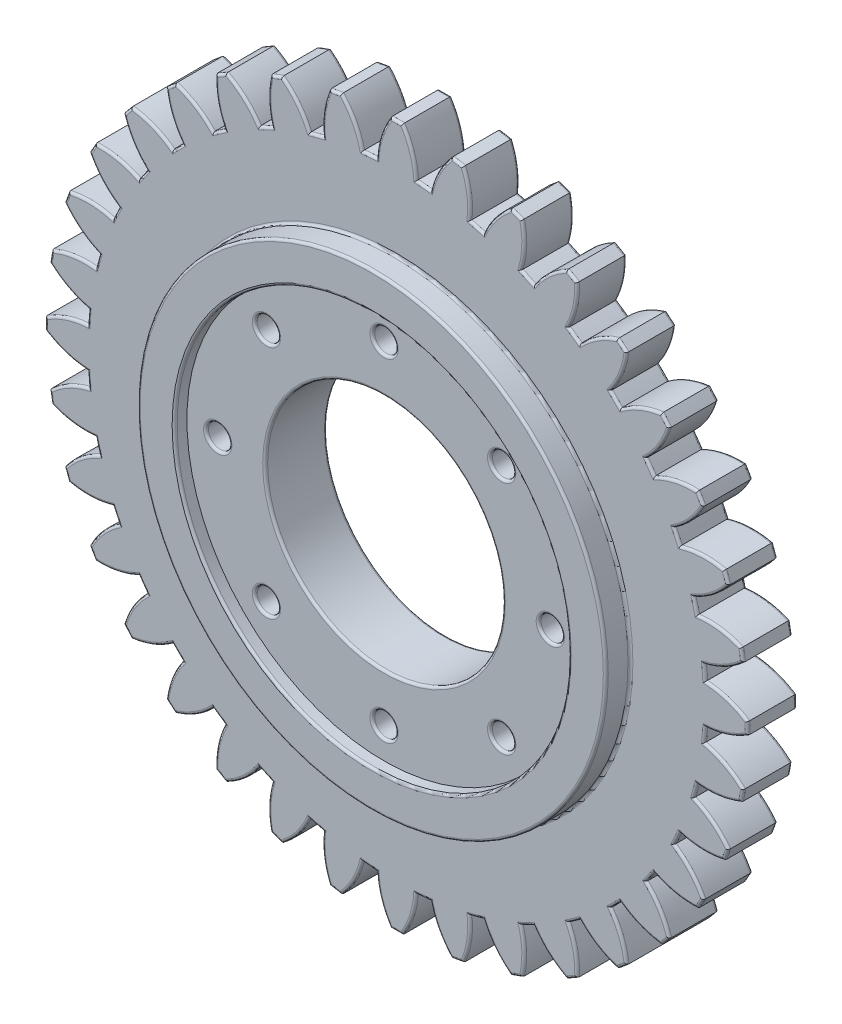
from build123d import *

# Parameters (mm, degrees)
SKETCH_1_R               = 25.125
EXTRUDE_1_DEPTH          = 4
EXTRUDE_2_DEPTH          = 4
PATTERN_CIRCULAR_1_COUNT = 36
SKETCH_2_R               = 9.65
CUT_EXTRUDE_1_DEPTH      = 10
EXTRUDE_START            = 1
SKETCH_4_R               = 16
SKETCH_4_R_2             = 9.65
EXTRUDE_3_DEPTH          = 1
SKETCH_5_R               = 0.95
CUT_EXTRUDE_2_DEPTH      = 41.614037135
EXTRUDE_START_2          = 2
SKETCH_6_R               = 19
SKETCH_6_R_2             = 16
EXTRUDE_4_DEPTH          = 2
FILLET_1_R               = 0.2


with BuildPart() as part:
    # 스케치1 → 보스-돌출1 (new body)
    with BuildSketch(Plane.XY):
        Circle(SKETCH_1_R)
    extrude(amount=EXTRUDE_1_DEPTH)

    # 스케치1<3> → 보스-돌출2 (add)
    with BuildSketch(Plane.XY):
        with BuildLine():
            add(Edge.make_bspline(
                [(0.485835725, 28.49585871), (1.498424124, 26.93681997), (1.610835725, 25.073309181)],
                knots=[0, 0, 0, 1, 1, 1], degree=2))
            ThreePointArc((0.485835725, 28.49585871), (0, 28.5), (-0.485835725, 28.49585871))
            add(Edge.make_bspline(
                [(-0.485835725, 28.49585871), (-1.498424124, 26.93681997), (-1.610835725, 25.073309181)],
                knots=[0, 0, 0, 1, 1, 1], degree=2))
            ThreePointArc((-1.610835725, 25.073309181), (0, 25.125), (1.610835725, 25.073309181))
        make_face()
    extrude_2 = extrude(amount=EXTRUDE_2_DEPTH)

    # 원형 패턴1: 보스-돌출2 ×36 about axis
    pattern_circular_1_axis = Axis((0, 0, 4), (0, 0, -1))
    for i in range(1, PATTERN_CIRCULAR_1_COUNT):
        add(extrude_2.rotate(pattern_circular_1_axis, i * 360 / PATTERN_CIRCULAR_1_COUNT))

    # 스케치2 → 컷-돌출1 (cut)
    with BuildSketch(Plane.XY.offset(4)):
        Circle(SKETCH_2_R)
    extrude(amount=-CUT_EXTRUDE_1_DEPTH, mode=Mode.SUBTRACT)

    # 스케치4 → 보스-돌출3 (add)
    with BuildSketch(Plane.XY.offset(4).offset(EXTRUDE_START)):
        Circle(SKETCH_4_R)
        Circle(SKETCH_4_R_2, mode=Mode.SUBTRACT)
    extrude(amount=-EXTRUDE_3_DEPTH)

    # 스케치5 → 컷-돌출2 (cut, through all)
    with BuildSketch(Plane.XY.offset(5)):
        with Locations((13.5, 0)):
            Circle(SKETCH_5_R)
        with Locations((9.545941546, -9.545941546)):
            Circle(SKETCH_5_R)
        with Locations((0, -13.5)):
            Circle(SKETCH_5_R)
        with Locations((-9.545941546, -9.545941546)):
            Circle(SKETCH_5_R)
        with Locations((-13.5, 0)):
            Circle(SKETCH_5_R)
        with Locations((-9.545941546, 9.545941546)):
            Circle(SKETCH_5_R)
        with Locations((0, 13.5)):
            Circle(SKETCH_5_R)
        with Locations((9.545941546, 9.545941546)):
            Circle(SKETCH_5_R)
    extrude(amount=-CUT_EXTRUDE_2_DEPTH, mode=Mode.SUBTRACT)

    # 스케치6 → 보스-돌출4 (add)
    with BuildSketch(Plane.XY.offset(4).offset(EXTRUDE_START_2)):
        Circle(SKETCH_6_R)
        Circle(SKETCH_6_R_2, mode=Mode.SUBTRACT)
    extrude(amount=-EXTRUDE_4_DEPTH)

    # 필렛1
    fillet_1_edges = [part.edges().sort_by_distance(p)[0] for p in [
        (-26.229523951, 5.918631747, 4),
        (-28.067020961, 4.948973064, 0),
        (-26.671981382, 3.409330963, 0),
        (-28.067020961, 4.948973064, 4),
        (-26.671981382, 3.409330963, 4),
        (-26.229523951, 5.918631747, 0),
        (-25.02939179, -2.189788037, 0),
        (-25.02939179, -2.189788037, 4),
        (-26.858798162, 1.274005397, 4),
        (-28.5, 0, 0),
        (-26.858798162, -1.274005397, 0),
        (-28.5, 0, 4),
        (-26.858798162, -1.274005397, 4),
        (-26.858798162, 1.274005397, 0),
        (-24.268886386, -6.502828508, 0),
        (-24.268886386, -6.502828508, 4),
        (-26.671981382, -3.409330963, 4),
        (-28.067020961, -4.948973064, 0),
        (-26.229523951, -5.918631747, 0),
        (-28.067020961, -4.948973064, 4),
        (-26.229523951, -5.918631747, 4),
        (-26.671981382, -3.409330963, 0),
        (-22.770983149, -10.618283826, 0),
        (-22.770983149, -10.618283826, 4),
        (-25.674749945, -7.989076527, 4),
        (-26.781239692, -9.747574085, 0),
        (-24.803278928, -10.383423467, 0),
        (-26.781239692, -9.747574085, 4),
        (-24.803278928, -10.383423467, 4),
        (-25.674749945, -7.989076527, 0),
        (-20.581195113, -14.411107963, 0),
        (-20.581195113, -14.411107963, 4),
        (-23.897404222, -12.326078043, 4),
        (-24.681724008, -14.25, 0),
        (-22.623398825, -14.532720119, 0),
        (-24.681724008, -14.25, 4),
        (-22.623398825, -14.532720119, 4),
        (-23.897404222, -12.326078043, 0),
        (-17.766057877, -17.766057877, 0),
        (-17.766057877, -17.766057877, 4),
        (-21.393947965, -16.288557915, 4),
        (-21.832266629, -18.319446876, 0),
        (-19.756118197, -18.240447425, 0),
        (-21.832266629, -18.319446876, 4),
        (-19.756118197, -18.240447425, 4),
        (-21.393947965, -16.288557915, 0),
        (-14.411107963, -20.581195113, 0),
        (-14.411107963, -20.581195113, 4),
        (-18.240447425, -19.756118197, 4),
        (-18.319446876, -21.832266629, 0),
        (-16.288557915, -21.393947965, 0),
        (-18.319446876, -21.832266629, 4),
        (-16.288557915, -21.393947965, 4),
        (-18.240447425, -19.756118197, 0),
        (-10.618283826, -22.770983149, 0),
        (-10.618283826, -22.770983149, 4),
        (-14.532720119, -22.623398825, 4),
        (-14.25, -24.681724008, 0),
        (-12.326078043, -23.897404222, 0),
        (-14.25, -24.681724008, 4),
        (-12.326078043, -23.897404222, 4),
        (-14.532720119, -22.623398825, 0),
        (-6.502828508, 24.268886386, 0),
        (-6.502828508, -24.268886386, 0),
        (-6.502828508, -24.268886386, 4),
        (-10.383423467, -24.803278928, 4),
        (-9.747574085, -26.781239692, 0),
        (-7.989076527, -25.674749945, 0),
        (-9.747574085, -26.781239692, 4),
        (-7.989076527, -25.674749945, 4),
        (-10.383423467, -24.803278928, 0),
        (-6.502828508, 24.268886386, 4),
        (-2.189788037, -25.02939179, 0),
        (-2.189788037, -25.02939179, 4),
        (-5.918631747, -26.229523951, 4),
        (-4.948973064, -28.067020961, 0),
        (-3.409330963, -26.671981382, 0),
        (-4.948973064, -28.067020961, 4),
        (-3.409330963, -26.671981382, 4),
        (-5.918631747, -26.229523951, 0),
        (-3.409330963, 26.671981382, 4),
        (-4.948973064, 28.067020961, 0),
        (2.189788037, -25.02939179, 0),
        (2.189788037, -25.02939179, 4),
        (-1.274005397, -26.858798162, 4),
        (0, -28.5, 0),
        (1.274005397, -26.858798162, 0),
        (-5.918631747, 26.229523951, 0),
        (0, -28.5, 4),
        (1.274005397, -26.858798162, 4),
        (-1.274005397, -26.858798162, 0),
        (-4.948973064, 28.067020961, 4),
        (6.502828508, -24.268886386, 0),
        (6.502828508, -24.268886386, 4),
        (3.409330963, -26.671981382, 4),
        (4.948973064, -28.067020961, 0),
        (-5.918631747, 26.229523951, 4),
        (5.918631747, -26.229523951, 0),
        (4.948973064, -28.067020961, 4),
        (5.918631747, -26.229523951, 4),
        (3.409330963, -26.671981382, 0),
        (-3.409330963, 26.671981382, 0),
        (10.618283826, -22.770983149, 0),
        (10.618283826, -22.770983149, 4),
        (7.989076527, -25.674749945, 4),
        (9.747574085, -26.781239692, 0),
        (10.383423467, -24.803278928, 0),
        (9.747574085, -26.781239692, 4),
        (10.383423467, -24.803278928, 4),
        (7.989076527, -25.674749945, 0),
        (14.411107963, -20.581195113, 0),
        (14.411107963, -20.581195113, 4),
        (12.326078043, -23.897404222, 4),
        (14.25, -24.681724008, 0),
        (14.532720119, -22.623398825, 0),
        (14.25, -24.681724008, 4),
        (14.532720119, -22.623398825, 4),
        (12.326078043, -23.897404222, 0),
        (17.766057877, -17.766057877, 0),
        (17.766057877, -17.766057877, 4),
        (16.288557915, -21.393947965, 4),
        (18.319446876, -21.832266629, 0),
        (18.240447425, -19.756118197, 0),
        (18.319446876, -21.832266629, 4),
        (18.240447425, -19.756118197, 4),
        (16.288557915, -21.393947965, 0),
        (20.581195113, -14.411107963, 0),
        (20.581195113, -14.411107963, 4),
        (19.756118197, -18.240447425, 4),
        (21.832266629, -18.319446876, 0),
        (21.393947965, -16.288557915, 0),
        (21.832266629, -18.319446876, 4),
        (21.393947965, -16.288557915, 4),
        (19.756118197, -18.240447425, 0),
        (22.770983149, -10.618283826, 0),
        (22.770983149, -10.618283826, 4),
        (22.623398825, -14.532720119, 4),
        (24.681724008, -14.25, 0),
        (23.897404222, -12.326078043, 0),
        (24.681724008, -14.25, 4),
        (23.897404222, -12.326078043, 4),
        (22.623398825, -14.532720119, 0),
        (24.268886386, -6.502828508, 0),
        (24.268886386, -6.502828508, 4),
        (24.803278928, -10.383423467, 4),
        (26.781239692, -9.747574085, 0),
        (25.674749945, -7.989076527, 0),
        (26.781239692, -9.747574085, 4),
        (25.674749945, -7.989076527, 4),
        (24.803278928, -10.383423467, 0),
        (25.02939179, -2.189788037, 0),
        (25.02939179, -2.189788037, 4),
        (-10.618283826, 22.770983149, 0),
        (26.229523951, -5.918631747, 4),
        (28.067020961, -4.948973064, 0),
        (26.671981382, -3.409330963, 0),
        (28.067020961, -4.948973064, 4),
        (26.671981382, -3.409330963, 4),
        (26.229523951, -5.918631747, 0),
        (-10.618283826, 22.770983149, 4),
        (25.02939179, 2.189788037, 0),
        (25.02939179, 2.189788037, 4),
        (26.858798162, -1.274005397, 4),
        (28.5, 0, 0),
        (26.858798162, 1.274005397, 0),
        (28.5, 0, 4),
        (26.858798162, 1.274005397, 4),
        (26.858798162, -1.274005397, 0),
        (-7.989076527, 25.674749945, 4),
        (24.268886386, 6.502828508, 0),
        (24.268886386, 6.502828508, 4),
        (-9.747574085, 26.781239692, 0),
        (26.671981382, 3.409330963, 4),
        (28.067020961, 4.948973064, 0),
        (26.229523951, 5.918631747, 0),
        (28.067020961, 4.948973064, 4),
        (26.229523951, 5.918631747, 4),
        (26.671981382, 3.409330963, 0),
        (-10.383423467, 24.803278928, 0),
        (22.770983149, 10.618283826, 0),
        (22.770983149, 10.618283826, 4),
        (-9.747574085, 26.781239692, 4),
        (25.674749945, 7.989076527, 4),
        (26.781239692, 9.747574085, 0),
        (24.803278928, 10.383423467, 0),
        (26.781239692, 9.747574085, 4),
        (24.803278928, 10.383423467, 4),
        (25.674749945, 7.989076527, 0),
        (-10.383423467, 24.803278928, 4),
        (-7.989076527, 25.674749945, 0),
        (20.581195113, 14.411107963, 0),
        (20.581195113, 14.411107963, 4),
        (23.897404222, 12.326078043, 4),
        (24.681724008, 14.25, 0),
        (22.623398825, 14.532720119, 0),
        (24.681724008, 14.25, 4),
        (22.623398825, 14.532720119, 4),
        (23.897404222, 12.326078043, 0),
        (17.766057877, 17.766057877, 0),
        (17.766057877, 17.766057877, 4),
        (21.393947965, 16.288557915, 4),
        (21.832266629, 18.319446876, 0),
        (19.756118197, 18.240447425, 0),
        (21.832266629, 18.319446876, 4),
        (19.756118197, 18.240447425, 4),
        (21.393947965, 16.288557915, 0),
        (14.411107963, 20.581195113, 0),
        (14.411107963, 20.581195113, 4),
        (18.240447425, 19.756118197, 4),
        (18.319446876, 21.832266629, 0),
        (16.288557915, 21.393947965, 0),
        (18.319446876, 21.832266629, 4),
        (16.288557915, 21.393947965, 4),
        (18.240447425, 19.756118197, 0),
        (10.618283826, 22.770983149, 0),
        (10.618283826, 22.770983149, 4),
        (14.532720119, 22.623398825, 4),
        (14.25, 24.681724008, 0),
        (12.326078043, 23.897404222, 0),
        (14.25, 24.681724008, 4),
        (12.326078043, 23.897404222, 4),
        (14.532720119, 22.623398825, 0),
        (6.502828508, 24.268886386, 0),
        (6.502828508, 24.268886386, 4),
        (10.383423467, 24.803278928, 4),
        (9.747574085, 26.781239692, 0),
        (7.989076527, 25.674749945, 0),
        (9.747574085, 26.781239692, 4),
        (7.989076527, 25.674749945, 4),
        (10.383423467, 24.803278928, 0),
        (2.189788037, 25.02939179, 0),
        (2.189788037, 25.02939179, 4),
        (5.918631747, 26.229523951, 4),
        (4.948973064, 28.067020961, 0),
        (3.409330963, 26.671981382, 0),
        (4.948973064, 28.067020961, 4),
        (3.409330963, 26.671981382, 4),
        (5.918631747, 26.229523951, 0),
        (-14.411107963, 20.581195113, 0),
        (-14.411107963, 20.581195113, 4),
        (-12.326078043, 23.897404222, 4),
        (-14.25, 24.681724008, 0),
        (-14.532720119, 22.623398825, 0),
        (-14.25, 24.681724008, 4),
        (-14.532720119, 22.623398825, 4),
        (-9.65, 0, 0),
        (-12.326078043, 23.897404222, 0),
        (-9.65, 0, 5),
        (12.55, 0, 0),
        (12.55, 0, 5),
        (8.595941546, -9.545941546, 0),
        (8.595941546, -9.545941546, 5),
        (-0.95, -13.5, 0),
        (-0.95, -13.5, 5),
        (-10.495941546, -9.545941546, 0),
        (-10.495941546, -9.545941546, 5),
        (-14.45, 0, 0),
        (-14.45, 0, 5),
        (-10.495941546, 9.545941546, 0),
        (-10.495941546, 9.545941546, 5),
        (-0.95, 13.5, 0),
        (-0.95, 13.5, 5),
        (8.595941546, 9.545941546, 0),
        (8.595941546, 9.545941546, 5),
        (-17.766057877, 17.766057877, 0),
        (-17.766057877, 17.766057877, 4),
        (-16, 0, 6),
        (-19, 0, 4),
        (-19, 0, 6),
        (-16.288557915, 21.393947965, 4),
        (-18.319446876, 21.832266629, 0),
        (-2.189788037, 25.02939179, 0),
        (-18.240447425, 19.756118197, 0),
        (-18.319446876, 21.832266629, 4),
        (-18.240447425, 19.756118197, 4),
        (-16.288557915, 21.393947965, 0),
        (-2.189788037, 25.02939179, 4),
        (-20.581195113, 14.411107963, 0),
        (-20.581195113, 14.411107963, 4),
        (-19.756118197, 18.240447425, 4),
        (-21.832266629, 18.319446876, 0),
        (-21.393947965, 16.288557915, 0),
        (-21.832266629, 18.319446876, 4),
        (-21.393947965, 16.288557915, 4),
        (-19.756118197, 18.240447425, 0),
        (1.274005397, 26.858798162, 4),
        (0, 28.5, 0),
        (-22.770983149, 10.618283826, 0),
        (-22.770983149, 10.618283826, 4),
        (-22.623398825, 14.532720119, 4),
        (-24.681724008, 14.25, 0),
        (-23.897404222, 12.326078043, 0),
        (-24.681724008, 14.25, 4),
        (-23.897404222, 12.326078043, 4),
        (-1.274005397, 26.858798162, 0),
        (-22.623398825, 14.532720119, 0),
        (-24.268886386, 6.502828508, 0),
        (0, 28.5, 4),
        (-24.268886386, 6.502828508, 4),
        (-24.803278928, 10.383423467, 4),
        (-26.781239692, 9.747574085, 0),
        (-25.674749945, 7.989076527, 0),
        (-1.274005397, 26.858798162, 4),
        (-26.781239692, 9.747574085, 4),
        (-25.674749945, 7.989076527, 4),
        (-24.803278928, 10.383423467, 0),
        (1.274005397, 26.858798162, 0),
        (-25.02939179, 2.189788037, 0),
        (-25.02939179, 2.189788037, 4),
    ]]
    fillet(fillet_1_edges, radius=FILLET_1_R)


solid = part.part
